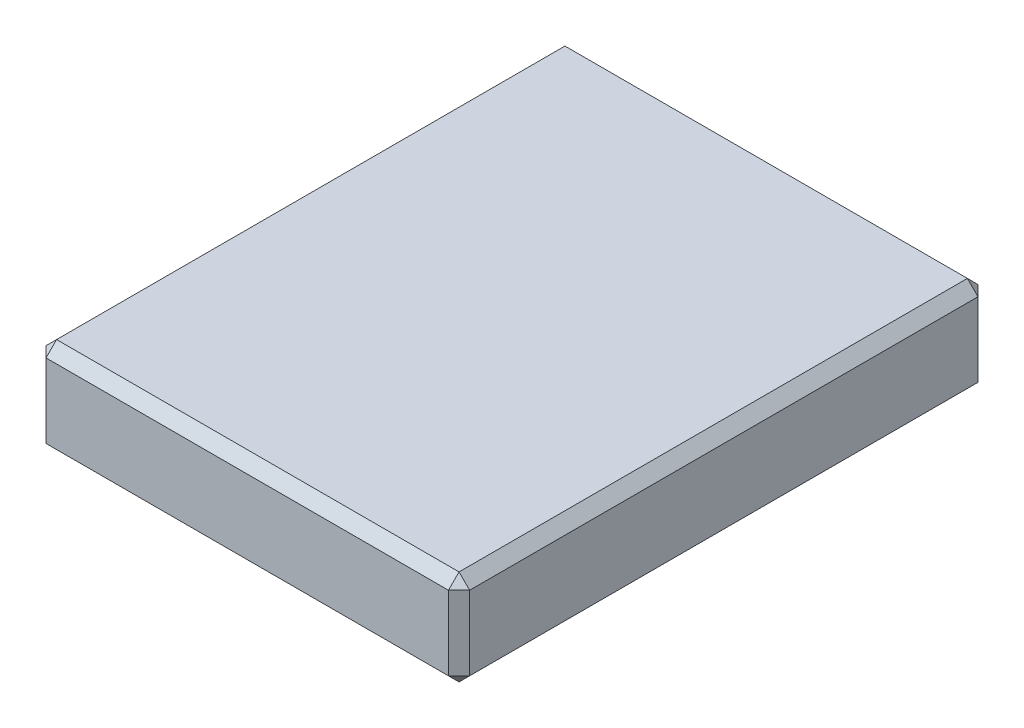
from build123d import *

# Parameters (mm, degrees)
SKETCH1_W           = 80
SKETCH1_H           = 100
BOSS_EXTRUDE1_DEPTH = 18
CHAMFER1_SIZE       = 2


with BuildPart() as part:
    # Sketch1 → Boss-Extrude1 (new body)
    with BuildSketch(Plane(origin=(0, 0, 0), x_dir=(1, 0, 0), z_dir=(0, 1, 0))):
        with Locations((40, -50)):
            Rectangle(SKETCH1_W, SKETCH1_H)
    extrude(amount=BOSS_EXTRUDE1_DEPTH)

    # Chamfer1
    chamfer1_edges = [part.edges().sort_by_distance(p)[0] for p in [
        (40, 18, 0),
        (40, 0, 0),
        (40, 18, 100),
        (0, 9, 0),
        (0, 18, 50),
        (0, 9, 100),
        (0, 0, 50),
        (40, 0, 100),
        (80, 9, 100),
        (80, 18, 50),
        (80, 9, 0),
        (80, 0, 50),
    ]]
    chamfer(chamfer1_edges, length=CHAMFER1_SIZE)


solid = part.part
